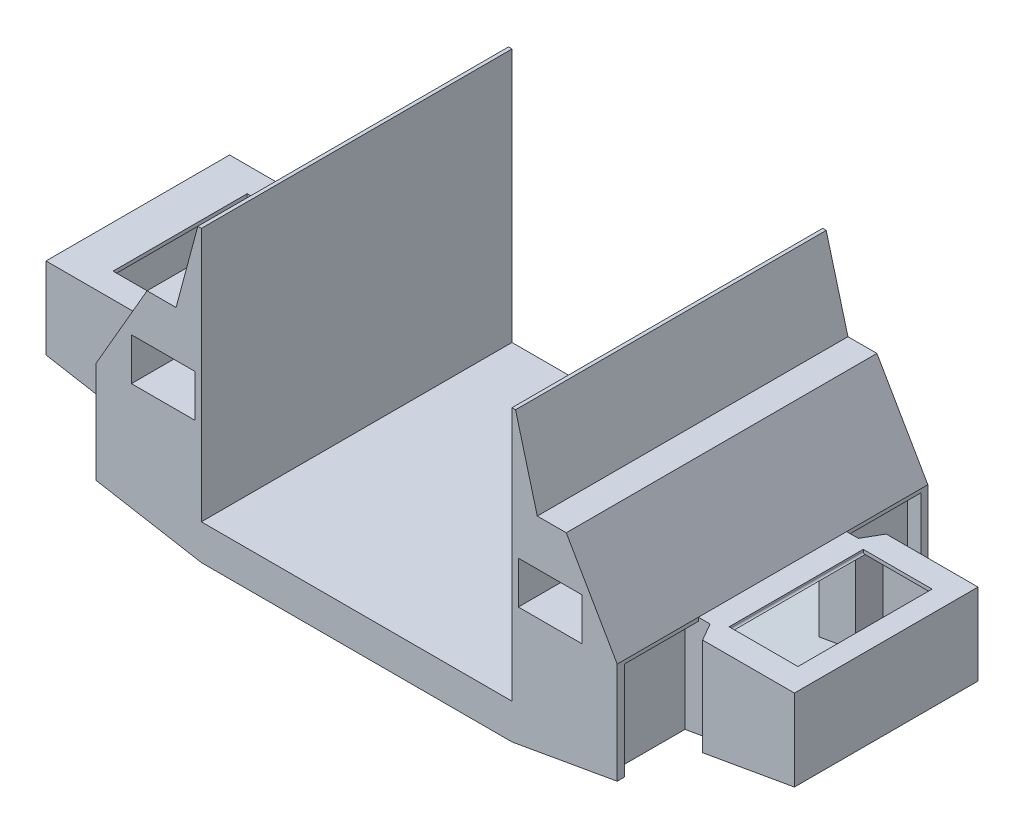
from build123d import *

# Parameters (mm, degrees)
EXTRUDE_1_DEPTH                 = 220
SKETCH_3_W                      = 130
SKETCH_3_H                      = 90
CUT_EXTRUDE_1_DEPTH             = 585.29444632
EXTRUDE_5_DEPTH                 = 10
EXTRUDE_START                   = -130
EXTRUDE_6_DEPTH                 = 260
EXTRUDE_START_2                 = -220
EXTRUDE_6_2_DEPTH               = 125
EXTRUDE_START_3                 = 95
EXTRUDE_6_3_DEPTH               = 125
EXTRUDE_START_4                 = -76.923226389
EXTRUDE_6_4_DEPTH               = 136.923226389
CUT_EXTRUDE_2_DEPTH             = 585.29444632
SKETCH_13_W                     = 90
SKETCH_13_H                     = 60
EXTRUDE_7_DEPTH                 = 10
EXTRUDE_10_REACH                = 649.534
SKETCH_16_W                     = 90
SKETCH_16_H                     = 60
EXTRUDE_10_DIRECTION_2_REACH    = 649.534
SKETCH_17_W                     = 65
SKETCH_17_H                     = 190
SKETCH_17_W_2                   = 95
EXTRUDE_15_DEPTH                = 5
CUT_EXTRUDE_3_REACH             = 649.534
CUT_EXTRUDE_3_DIRECTION_2_REACH = 649.534


with BuildPart() as part:
    # Эскиз1 → Бобышка-Вытянуть1 (new, symmetric)
    with BuildSketch(Plane.XY):
        Polygon((-219.125113365, -100), (219.125113365, -100), (530, -45.184369862), (530, -55.33863598), (220, -110), (-220, -110), (-530, -55.33863598), (-530, -45.184369862), align=None)
    extrude(amount=EXTRUDE_1_DEPTH, both=True)

    # Эскиз3 → Вырез-Вытянуть1 (cut, through all)
    with BuildSketch(Plane(origin=(0, 0, 0), x_dir=(1, 0, 0), z_dir=(0, 1, 0))):
        with Locations((-465, 175)):
            Rectangle(SKETCH_3_W, SKETCH_3_H)
        with Locations((465, 175)):
            Rectangle(SKETCH_3_W, SKETCH_3_H)
        with Locations((465, -175)):
            Rectangle(SKETCH_3_W, SKETCH_3_H)
        with Locations((-465, -175)):
            Rectangle(SKETCH_3_W, SKETCH_3_H)
    extrude(amount=-CUT_EXTRUDE_1_DEPTH, mode=Mode.SUBTRACT)

    # Эскиз9 → Бобышка-Вытянуть5 (add)
    with BuildSketch(Plane.XY.offset(130)):
        Polygon((-530, -45.184369862), (-400, -68.106877354), (-400, 60), (-530, 60), align=None)
        Polygon((400, -68.106877354), (400, 60), (530, 60), (530, -45.184369862), align=None)
    extrude_5 = extrude(amount=-EXTRUDE_5_DEPTH)

    # Зеркальное отражение3: Бобышка-Вытянуть5 across plane
    add(extrude_5.mirror(Plane.XY))

    # Бобышка-Вытянуть6: read off the stored shape, not the designer's step
    # Бобышка-Вытянуть6 outline → Бобышка-Вытянуть6 (add)
    with BuildSketch(Plane.XY.offset(EXTRUDE_START)):
        Polygon((-530, 60), (-530, -45.184369862), (-520, -46.947639669), (-520, 60), align=None)
        Polygon((530, -45.184369862), (530, 60), (520, 60), (520, -46.947639669), align=None)
    extrude(amount=EXTRUDE_6_DEPTH)

    # Extrude 6 2 outline → Extrude 6 2 (add)
    with BuildSketch(Plane.XY.offset(EXTRUDE_START_2)):
        Polygon((-350, 60), (-350, -76.923226389), (-340, -78.686496196), (-340, 60), align=None)
        Polygon((350, -76.923226389), (350, 60), (340, 60), (340, -78.686496196), align=None)
    extrude(amount=EXTRUDE_6_2_DEPTH)

    # Extrude 6 3 outline → Extrude 6 3 (add)
    with BuildSketch(Plane.XY.offset(EXTRUDE_START_3)):
        Polygon((-350, 60), (-350, -76.923226389), (-340, -78.686496196), (-340, 60), align=None)
        Polygon((350, -76.923226389), (350, 60), (340, 60), (340, -78.686496196), align=None)
    extrude(amount=EXTRUDE_6_3_DEPTH)

    # Extrude 6 4 outline → Extrude 6 4 (add)
    with BuildSketch(Plane(origin=(0, 0, 0), x_dir=(1, 0, 0), z_dir=(0, 1, 0)).offset(EXTRUDE_START_4)):
        Polygon((350, -105), (385.56624327, -105), (400, -130), (400, -120), (405.773502692, -120), (391.339745962, -95), (350, -95), align=None)
        Polygon((-400, -130), (-385.56624327, -105), (-350, -105), (-350, -95), (-391.339745962, -95), (-405.773502692, -120), (-400, -120), align=None)
        Polygon((-400, 120), (-405.773502692, 120), (-391.339745962, 95), (-350, 95), (-350, 105), (-385.56624327, 105), (-400, 130), align=None)
        Polygon((400, 130), (385.56624327, 105), (350, 105), (350, 95), (391.339745962, 95), (405.773502692, 120), (400, 120), align=None)
    extrude(amount=EXTRUDE_6_4_DEPTH)

    # Эскиз12 → Вырез-Вытянуть2 (cut, through all)
    with BuildSketch(Plane(origin=(0, 0, 0), x_dir=(1, 0, 0), z_dir=(0, 1, 0))):
        Polygon((350, -105), (350, -220), (400, -220), (400, -130), (385.56624327, -105), align=None)
        Polygon((400, 220), (350, 220), (350, 105), (385.56624327, 105), (400, 130), align=None)
        Polygon((-400, -220), (-350, -220), (-350, -105), (-385.56624327, -105), (-400, -130), align=None)
        Polygon((-400, 130), (-385.56624327, 105), (-350, 105), (-350, 220), (-400, 220), align=None)
    extrude(amount=-CUT_EXTRUDE_2_DEPTH, mode=Mode.SUBTRACT)

    # Эскиз13 → Бобышка-Вытянуть7 (add)
    # profile 1 of 2: a face of its own
    with BuildSketch(Plane.XY.offset(220)):
        Polygon((-296.831216351, 185), (-369, 60), (-369, -83.727279874), (-350, -87.077492508), (-350, 60), (-340, 60), (-340, -78.686496196), (-219.125113365, -100), (219.125113365, -100), (340, -78.686496196), (340, 60), (350, 60), (350, -87.077492508), (369, -83.727279874), (369, 60), (296.831216351, 185), (255.81415713, 185), (225, 300), (220, 300), (220, -60), (-220, -60), (-220, 300), (-225, 300), (-255.81415713, 185), align=None)
        with Locations((-274, 90)):
            Rectangle(SKETCH_13_W, SKETCH_13_H, mode=Mode.SUBTRACT)
        with Locations((274, 90)):
            Rectangle(SKETCH_13_W, SKETCH_13_H, mode=Mode.SUBTRACT)
    # profile 2 of 2: a face of its own
    with BuildSketch(Plane.XY.offset(220)):
        Polygon((-350, 60), (-350, -87.077492508), (-220, -110), (220, -110), (350, -87.077492508), (350, 60), (340, 60), (340, -78.686496196), (219.125113365, -100), (-219.125113365, -100), (-340, -78.686496196), (-340, 60), align=None)
    extrude_7 = extrude(amount=-EXTRUDE_7_DEPTH)

    # Зеркальное отражение4: Бобышка-Вытянуть7 across plane
    add(extrude_7.mirror(Plane.XY))

    # Эскиз16 → Бобышка-Вытянуть10 (add, up to next)
    with BuildSketch(Plane.XY, mode=Mode.PRIVATE) as extrude_10_sk1:
        Polygon((369, 60), (296.831216351, 185), (255.81415713, 185), (225, 300), (220, 300), (220, -60), (-220, -60), (-220, 300), (-225, 300), (-255.81415713, 185), (-296.831216351, 185), (-369, 60), (-369, 55), (-359, 55), (-350, 55), (-350, 60), (-357.452994616, 60), (-324, 117.942286341), (-324, 55), (-230, 55), (-230, -70), (230, -70), (230, 55), (324, 55), (324, 117.942286341), (357.452994616, 60), (350, 60), (350, 55), (359, 55), (369, 55), align=None)
        Polygon((-291.057713659, 175), (-248.14088725, 175), (-230, 242.702712911), (-230, 125), (-319.925227119, 125), align=None, mode=Mode.SUBTRACT)
        Polygon((230, 242.702712911), (230, 125), (319.925227119, 125), (291.057713659, 175), (248.14088725, 175), align=None, mode=Mode.SUBTRACT)
        with Locations((-274, 90)):
            Rectangle(SKETCH_16_W, SKETCH_16_H, mode=Mode.SUBTRACT)
        with Locations((274, 90)):
            Rectangle(SKETCH_16_W, SKETCH_16_H, mode=Mode.SUBTRACT)
    extrude_10_tool1 = extrude(extrude_10_sk1.sketch, amount=EXTRUDE_10_REACH, mode=Mode.PRIVATE) - part.part
    add(extrude_10_tool1.solids().sort_by_distance((325.766077, 118.372216, 0))[0])

    # Эскиз16 → Бобышка-Вытянуть10 direction 2 (add, up to next)
    with BuildSketch(Plane.XY, mode=Mode.PRIVATE) as extrude_10_direction_2_sk1:
        Polygon((369, 60), (296.831216351, 185), (255.81415713, 185), (225, 300), (220, 300), (220, -60), (-220, -60), (-220, 300), (-225, 300), (-255.81415713, 185), (-296.831216351, 185), (-369, 60), (-369, 55), (-359, 55), (-350, 55), (-350, 60), (-357.452994616, 60), (-324, 117.942286341), (-324, 55), (-230, 55), (-230, -70), (230, -70), (230, 55), (324, 55), (324, 117.942286341), (357.452994616, 60), (350, 60), (350, 55), (359, 55), (369, 55), align=None)
        Polygon((-291.057713659, 175), (-248.14088725, 175), (-230, 242.702712911), (-230, 125), (-319.925227119, 125), align=None, mode=Mode.SUBTRACT)
        Polygon((230, 242.702712911), (230, 125), (319.925227119, 125), (291.057713659, 175), (248.14088725, 175), align=None, mode=Mode.SUBTRACT)
        with Locations((-274, 90)):
            Rectangle(SKETCH_16_W, SKETCH_16_H, mode=Mode.SUBTRACT)
        with Locations((274, 90)):
            Rectangle(SKETCH_16_W, SKETCH_16_H, mode=Mode.SUBTRACT)
    extrude_10_direction_2_tool1 = extrude(extrude_10_direction_2_sk1.sketch, amount=-EXTRUDE_10_DIRECTION_2_REACH, mode=Mode.PRIVATE) - part.part
    add(extrude_10_direction_2_tool1.solids().sort_by_distance((325.766077, 118.372216, 0))[0])

    # Эскиз17 → Бобышка-Вытянуть15 (add)
    # profile 1 of 2: a face of its own
    with BuildSketch(Plane(origin=(0, 60, 0), x_dir=(1, 0, 0), z_dir=(0, 1, 0))):
        Polygon((-391.339745962, -95), (-369, -95), (-369, 95), (-391.339745962, 95), (-405.773502692, 120), (-520, 120), (-520, -120), (-405.773502692, -120), align=None)
        with Locations((-437.5, 0)):
            Rectangle(SKETCH_17_W, SKETCH_17_H, mode=Mode.SUBTRACT)
    # profile 2 of 2: a face of its own
    with BuildSketch(Plane(origin=(0, 60, 0), x_dir=(1, 0, 0), z_dir=(0, 1, 0))):
        Polygon((385.56624327, 105), (369, 105), (369, -105), (385.56624327, -105), (400, -130), (530, -130), (530, 130), (400, 130), align=None)
        with Locations((452.5, 0)):
            Rectangle(SKETCH_17_W_2, SKETCH_17_H, mode=Mode.SUBTRACT)
    extrude(amount=-EXTRUDE_15_DEPTH)

    # Вырез-Вытянуть3: up to this face of the body (flat: up to its plane)
    cut_extrude_3_end = Plane(part.part.faces().sort_by_distance((-437.5, 57.5, -95))[0])
    # Эскиз18 → Вырез-Вытянуть3 (cut, up to the picked face)
    with BuildSketch(Plane.XY, mode=Mode.PRIVATE) as cut_extrude_3_sk1:
        with BuildLine():
            Line((-405, 55), (-405, 60))
            Line((-405, 60), (-402.5, 60))
            Line((-402.5, 60), (-402.5, 57.5))
            ThreePointArc((-402.5, 57.5), (-403.232233047, 55.732233047), (-405, 55))
        make_face()
    cut_extrude_3_tool1 = split(extrude(cut_extrude_3_sk1.sketch, amount=-CUT_EXTRUDE_3_REACH, mode=Mode.PRIVATE), bisect_by=cut_extrude_3_end, keep=Keep.BOTH, mode=Mode.PRIVATE)
    # Эскиз18 → Вырез-Вытянуть3 (cut, up to the picked face)
    with BuildSketch(Plane.XY, mode=Mode.PRIVATE) as cut_extrude_3_sk2:
        with BuildLine():
            Line((405, 55), (405, 60))
            Line((405, 60), (402.5, 60))
            Line((402.5, 60), (402.5, 57.5))
            ThreePointArc((402.5, 57.5), (403.232233047, 55.732233047), (405, 55))
        make_face()
    cut_extrude_3_tool2 = split(extrude(cut_extrude_3_sk2.sketch, amount=-CUT_EXTRUDE_3_REACH, mode=Mode.PRIVATE), bisect_by=cut_extrude_3_end, keep=Keep.BOTH, mode=Mode.PRIVATE)
    add(cut_extrude_3_tool1.solids().sort_by(Axis((-403.833127, 57.733375, 0), (0, 0, -1)))[0], mode=Mode.SUBTRACT)
    add(cut_extrude_3_tool2.solids().sort_by(Axis((403.833127, 57.733375, 0), (0, 0, -1)))[0], mode=Mode.SUBTRACT)

    # Вырез-Вытянуть3 direction 2: up to this face of the body (flat: up to its plane)
    cut_extrude_3_direction_2_end = Plane(part.part.faces().sort_by_distance((-437.5, 57.5, 95))[0])
    # Эскиз18 → Вырез-Вытянуть3 direction 2 (cut, up to the picked face)
    with BuildSketch(Plane.XY, mode=Mode.PRIVATE) as cut_extrude_3_direction_2_sk1:
        with BuildLine():
            Line((-405, 55), (-405, 60))
            Line((-405, 60), (-402.5, 60))
            Line((-402.5, 60), (-402.5, 57.5))
            ThreePointArc((-402.5, 57.5), (-403.232233047, 55.732233047), (-405, 55))
        make_face()
    cut_extrude_3_direction_2_tool1 = split(extrude(cut_extrude_3_direction_2_sk1.sketch, amount=CUT_EXTRUDE_3_DIRECTION_2_REACH, mode=Mode.PRIVATE), bisect_by=cut_extrude_3_direction_2_end, keep=Keep.BOTH, mode=Mode.PRIVATE)
    # Эскиз18 → Вырез-Вытянуть3 direction 2 (cut, up to the picked face)
    with BuildSketch(Plane.XY, mode=Mode.PRIVATE) as cut_extrude_3_direction_2_sk2:
        with BuildLine():
            Line((405, 55), (405, 60))
            Line((405, 60), (402.5, 60))
            Line((402.5, 60), (402.5, 57.5))
            ThreePointArc((402.5, 57.5), (403.232233047, 55.732233047), (405, 55))
        make_face()
    cut_extrude_3_direction_2_tool2 = split(extrude(cut_extrude_3_direction_2_sk2.sketch, amount=CUT_EXTRUDE_3_DIRECTION_2_REACH, mode=Mode.PRIVATE), bisect_by=cut_extrude_3_direction_2_end, keep=Keep.BOTH, mode=Mode.PRIVATE)
    add(cut_extrude_3_direction_2_tool1.solids().sort_by(Axis((-403.833127, 57.733375, 0), (0, 0, 1)))[0], mode=Mode.SUBTRACT)
    add(cut_extrude_3_direction_2_tool2.solids().sort_by(Axis((403.833127, 57.733375, 0), (0, 0, 1)))[0], mode=Mode.SUBTRACT)


solid = part.part
